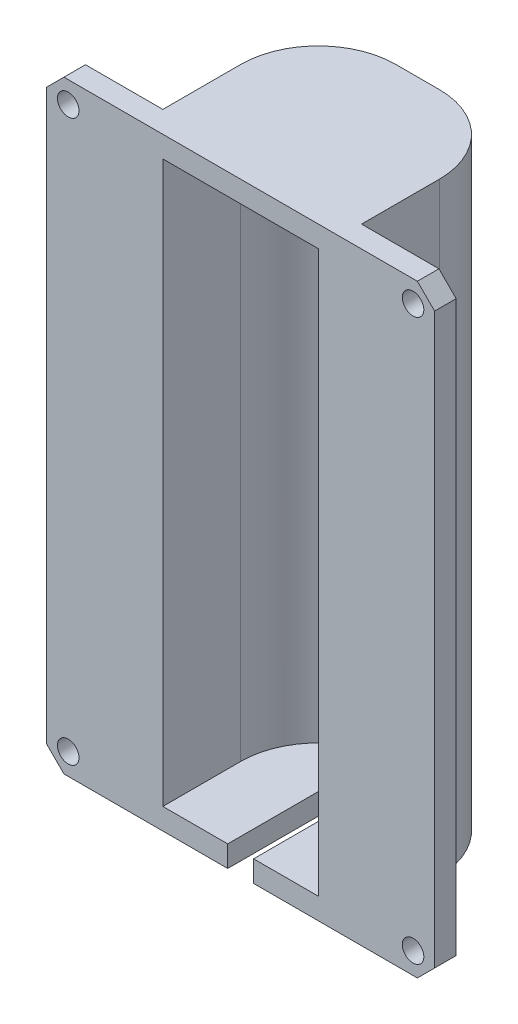
from build123d import *

# Parameters (mm, degrees)
BOSS_EXTRUDE1_DEPTH               = 18.03
SKETCH1_3_W                       = 45
SKETCH1_3_H                       = 70
BOSS_EXTRUDE2_DEPTH               = 5.5
FILLET1_R                         = 9
CUT_EXTRUDE1_DEPTH                = 103
TAP_DRILL_FOR_M3_TAP1_D           = 2.5
TAP_DRILL_FOR_M3_TAP1_CSINK_D     = 2.55
TAP_DRILL_FOR_M3_TAP1_CSINK_ANGLE = 90
CHAMFER1_SIZE                     = 2
FILLET2_R                         = 9


with BuildPart() as part:
    # Sketch1 → Boss-Extrude1 (new body)
    with BuildSketch(Plane.XY):
        Polygon((1.5, -35), (22.5, -35), (22.5, 35), (-22.5, 35), (-22.5, -35), (-1.5, -35), (-1.5, -32.525), (-9.025, -32.525), (-9.025, 32.525), (9.025, 32.525), (9.025, -32.525), (1.5, -32.525), align=None)
    extrude(amount=BOSS_EXTRUDE1_DEPTH)

    # Sketch1<3> → Boss-Extrude2 (add)
    with BuildSketch(Plane.XY):
        Rectangle(SKETCH1_3_W, SKETCH1_3_H)
    extrude(amount=-BOSS_EXTRUDE2_DEPTH)

    # Fillet1
    fillet1_edges = [part.edges().sort_by_distance(p)[0] for p in [
        (-9.025, 0, 0),
        (9.025, 0, 0),
    ]]
    fillet(fillet1_edges, radius=FILLET1_R)

    # Sketch4 → Cut-Extrude1 (cut)
    with BuildSketch(Plane.XZ.offset(35)):
        Polygon((-11.525, 15.53), (-22.5, 15.53), (-22.5, -5.5), (22.5, -5.5), (22.5, 15.53), (11.525, 15.53), (11.525, -2.5), (-11.525, -2.5), align=None)
    extrude(amount=-CUT_EXTRUDE1_DEPTH, mode=Mode.SUBTRACT)

    # Tap Drill for M3 Tap1 (through all)
    with Locations(Plane(origin=(0, 0, -5.5), x_dir=(-1, 0, 0), z_dir=(0, 0, -1))):
        with Locations((20, 32.5), (-20, 32.5), (-20, -32.5), (20, -32.5)):
            CounterSinkHole(TAP_DRILL_FOR_M3_TAP1_D / 2, TAP_DRILL_FOR_M3_TAP1_CSINK_D / 2, counter_sink_angle=TAP_DRILL_FOR_M3_TAP1_CSINK_ANGLE)

    # Chamfer1
    chamfer1_edges = [part.edges().sort_by_distance(p)[0] for p in [
        (22.5, -35, 16.78),
        (22.5, 35, 16.78),
        (-22.5, 35, 16.78),
        (-22.5, -35, 16.78),
    ]]
    chamfer(chamfer1_edges, length=CHAMFER1_SIZE)

    # Fillet2
    fillet2_edges = [part.edges().sort_by_distance(p)[0] for p in [
        (-11.525, 0, -2.5),
        (11.525, 0, -2.5),
    ]]
    fillet(fillet2_edges, radius=FILLET2_R)


solid = part.part
